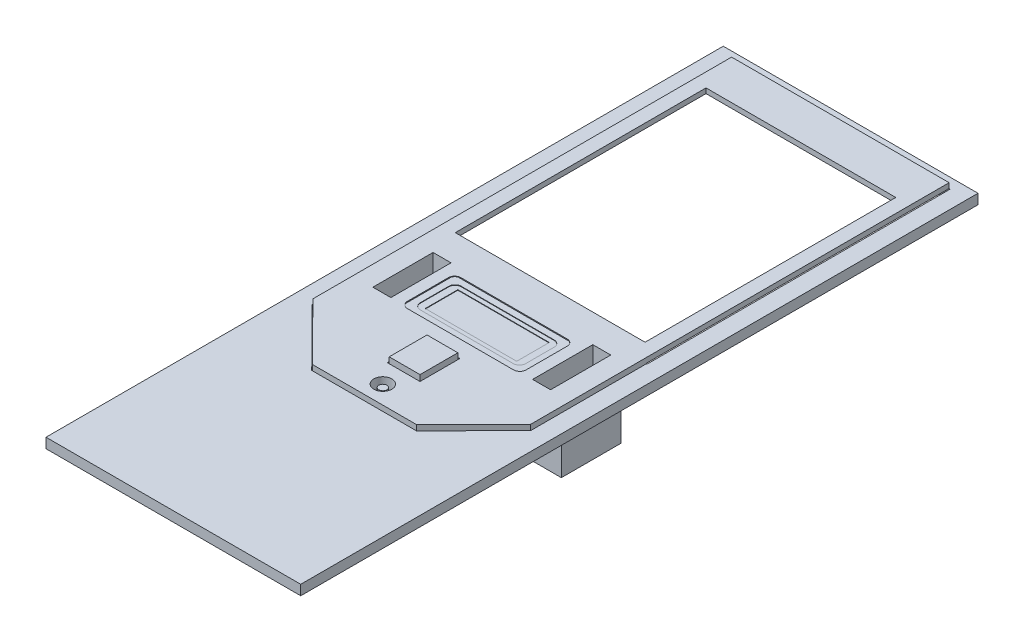
from build123d import *

# Parameters (mm, degrees)
SKETCH1_W                   = 51.332398317
SKETCH1_H                   = 136.325385694
BOSS_EXTRUDE1_DEPTH         = 2
CUT_EXTRUDE1_DEPTH          = 1
SKETCH3_W                   = 26.718092566
SKETCH3_H                   = 51.160838605
CUT_EXTRUDE2_DEPTH          = 1
SKETCH4_W                   = 20.659186536
SKETCH4_H                   = 13.604488078
BOSS_EXTRUDE2_DEPTH         = 1
SKETCH5_W                   = 6.521739131
SKETCH5_H                   = 14.853538096
SKETCH5_W_2                 = 6.52173913
SKETCH5_H_2                 = 15.644764374
CUT_EXTRUDE3_DEPTH          = 1
SKETCH6_W                   = 6.171107994
SKETCH6_H                   = 7.573632539
CUT_EXTRUDE4_DEPTH          = 1
SKETCH7_R                   = 2.489481066
CUT_EXTRUDE5_DEPTH          = 1
BOSS_EXTRUDE3_DEPTH         = 1
SKETCH10_W                  = 6.171107994
SKETCH10_H                  = 7.573632539
BOSS_EXTRUDE4_DEPTH         = 4
BOSS_EXTRUDE5_DEPTH         = 2
SKETCH12_W                  = 6.571107994
SKETCH12_H                  = 7.973632539
CUT_EXTRUDE6_DEPTH          = 2
SKETCH13_R                  = 1.8
SKETCH13_W                  = 26.718092566
SKETCH13_H                  = 51.160838605
CUT_EXTRUDE9_DEPTH          = 2
SKETCH14_R                  = 2.2
SKETCH14_R_2                = 1.8
BOSS_EXTRUDE11_DEPTH        = 2
SKETCH17_R                  = 2.2
BOSS_EXTRUDE12_DEPTH        = 1
SKETCH18_R                  = 0.8
BOSS_EXTRUDE15_DEPTH        = 3.4
EXTRUDE_THIN3_OUTLINE_W     = 5.6
EXTRUDE_THIN3_OUTLINE_H     = 14.844764374
EXTRUDE_THIN3_OUTLINE_W_2   = 3.6
EXTRUDE_THIN3_OUTLINE_H_2   = 12.844764374
EXTRUDE_THIN3_DEPTH         = 13.32398317
EXTRUDE_THIN3_2_OUTLINE_W   = 5.6
EXTRUDE_THIN3_2_OUTLINE_H   = 14.053538096
EXTRUDE_THIN3_2_OUTLINE_W_2 = 3.6
EXTRUDE_THIN3_2_OUTLINE_H_2 = 12.053538096
EXTRUDE_THIN3_2_DEPTH       = 13.32398317
SKETCH26_W                  = 3.6
SKETCH26_H                  = 12.053538096
SKETCH26_H_2                = 12.844764374
CUT_EXTRUDE12_DEPTH         = 13.32398317
SKETCH27_W                  = 5.6
SKETCH27_H                  = 14.053538096
BOSS_EXTRUDE18_DEPTH        = 1
SKETCH27_W_2                = 5.570395019
SKETCH27_H_2                = 14.844764374
BOSS_EXTRUDE18_2_DEPTH      = 1
SKETCH28_W                  = 20.659186536
SKETCH28_H                  = 13.604488078
CUT_EXTRUDE13_DEPTH         = 1
SKETCH29_W                  = 23.777559608
SKETCH29_H                  = 10.728152402
CUT_EXTRUDE15_DEPTH         = 10
SKETCH30_W                  = 23.777559608
SKETCH30_H                  = 10.728152402
SKETCH30_W_2                = 21.112762974
SKETCH30_H_2                = 8.203608222
BOSS_EXTRUDE20_DEPTH        = 1.8
SKETCH31_W                  = 21.112762974
SKETCH31_H                  = 8.203608222
BOSS_EXTRUDE21_DEPTH        = 1.6
SKETCH35_W                  = 23.977559608
SKETCH35_H                  = 10.928152402
CUT_EXTRUDE21_DEPTH         = 1.9
FILLET2_R                   = 1.25
FILLET3_R                   = 1.25
SKETCH37_W                  = 18.307713885
SKETCH37_H                  = 6.527591392
CUT_EXTRUDE22_DEPTH         = 0.1
SKETCH41_W                  = 18.307713885
SKETCH41_H                  = 6.527591392
BOSS_EXTRUDE27_DEPTH        = 0.1
SKETCH43_W                  = 18.307713885
SKETCH43_H                  = 6.527591392
BOSS_EXTRUDE28_DEPTH        = 0.1
CUT_EXTRUDE24_DEPTH         = 40.1
SKETCH51_W                  = 5.6
SKETCH51_H                  = 4.468914857
BOSS_EXTRUDE29_DEPTH        = 1
BOSS_EXTRUDE29_2_DEPTH      = 1
SKETCH52_W                  = 5.6
SKETCH52_H                  = 1
BOSS_EXTRUDE30_DEPTH        = 2.5
BOSS_EXTRUDE30_2_DEPTH      = 2.5
SKETCH53_W                  = 5.6
SKETCH53_H                  = 1
BOSS_EXTRUDE31_DEPTH        = 1
BOSS_EXTRUDE32_START        = 7.421556697
BOSS_EXTRUDE32_DEPTH        = 5.6
BOSS_EXTRUDE32_START_2      = -24.556002911
BOSS_EXTRUDE32_2_DEPTH      = 5.6
SKETCH55_W                  = 3.6
SKETCH55_H                  = 0.791226278
BOSS_EXTRUDE33_DEPTH        = 14.323983
SKETCH56_W                  = 0.791226278
SKETCH56_H                  = 13.32398317
CUT_EXTRUDE25_DEPTH         = 5.6
CUT_EXTRUDE_THIN1_DEPTH     = 1
SKETCH59_W                  = 71.33
SKETCH59_H                  = 156.33
SKETCH59_W_2                = 51.33
SKETCH59_H_2                = 136.33
CUT_EXTRUDE_THIN2_DEPTH     = 10
SKETCH60_W                  = 71
SKETCH60_H                  = 156
SKETCH60_W_2                = 51
SKETCH60_H_2                = 136
CUT_EXTRUDE_THIN3_DEPTH     = 10
SKETCH61_W                  = 51
SKETCH61_H                  = 2
CUT_EXTRUDE26_DEPTH         = 0.4
SKETCH62_W                  = 38
SKETCH62_H                  = 51.160838605
CUT_EXTRUDE28_DEPTH         = 10
SKETCH64_W                  = 38
SKETCH64_H                  = 0.08
BOSS_EXTRUDE35_DEPTH        = 2
SKETCH65_W                  = 38
SKETCH65_H                  = 0.08
BOSS_EXTRUDE37_DEPTH        = 1
SKETCH67_W                  = 44
SKETCH67_H                  = 61.400838605
CUT_EXTRUDE31_DEPTH         = 2
SKETCH69_W                  = 40.716981818
SKETCH69_H                  = 1
BOSS_EXTRUDE39_DEPTH        = 1.863286117
SKETCH70_W                  = 44
SKETCH70_H                  = 2
BOSS_EXTRUDE40_DEPTH        = 1
SKETCH71_W                  = 38
SKETCH71_H                  = 1
CUT_EXTRUDE32_DEPTH         = 1
SKETCH72_W                  = 38
SKETCH72_H                  = 1
BOSS_EXTRUDE41_DEPTH        = 1.8
SKETCH73_W                  = 44
SKETCH73_H                  = 2
CUT_EXTRUDE33_DEPTH         = 0.3
SKETCH74_W                  = 43.548387097
SKETCH74_H                  = 1
BOSS_EXTRUDE43_DEPTH        = 1.812426367


with BuildPart() as part:
    # Sketch1 → Boss-Extrude1 (new body)
    with BuildSketch(Plane(origin=(0, 0, 0), x_dir=(1, 0, 0), z_dir=(0, 1, 0))):
        with Locations((-5.767223106, -3.58751015)):
            Rectangle(SKETCH1_W, SKETCH1_H)
    extrude(amount=BOSS_EXTRUDE1_DEPTH)

    # Sketch2 → Cut-Extrude1 (cut)
    with BuildSketch(Plane(origin=(0, 2, 0), x_dir=(1, 0, 0), z_dir=(0, 1, 0))):
        Polygon((-27.541416655, -30.445855171), (-27.541416655, 60.542924633), (16.006970442, 60.542924633), (16.006970442, -30.445855171), (4.678976052, -41.666051524), (-16.213422265, -41.666051524), align=None)
    extrude(amount=-CUT_EXTRUDE1_DEPTH, mode=Mode.SUBTRACT)

    # Sketch3 → Cut-Extrude2 (cut)
    with BuildSketch(Plane(origin=(0, 1, 0), x_dir=(1, 0, 0), z_dir=(0, 1, 0))):
        with Locations((-5.767223107, 30.754931698)):
            Rectangle(SKETCH3_W, SKETCH3_H)
    extrude(amount=-CUT_EXTRUDE2_DEPTH, mode=Mode.SUBTRACT)

    # Sketch4 → Boss-Extrude2 (add)
    with BuildSketch(Plane(origin=(0, 1, 0), x_dir=(1, 0, 0), z_dir=(0, 1, 0))):
        with Locations((-5.767223107, -7.988180452)):
            Rectangle(SKETCH4_W, SKETCH4_H)
    extrude(amount=BOSS_EXTRUDE2_DEPTH)

    # Sketch5 → Cut-Extrude3 (cut)
    with BuildSketch(Plane(origin=(0, 1, 0), x_dir=(1, 0, 0), z_dir=(0, 1, 0))):
        with Locations((-21.756002911, -7.426769048)):
            Rectangle(SKETCH5_W, SKETCH5_H)
        with Locations((10.221556697, -7.031155909)):
            Rectangle(SKETCH5_W_2, SKETCH5_H_2)
    extrude(amount=-CUT_EXTRUDE3_DEPTH, mode=Mode.SUBTRACT)

    # Sketch6 → Cut-Extrude4 (cut)
    with BuildSketch(Plane(origin=(0, 1, 0), x_dir=(1, 0, 0), z_dir=(0, 1, 0))):
        with Locations((-5.767223107, -21.101784941)):
            Rectangle(SKETCH6_W, SKETCH6_H)
    extrude(amount=-CUT_EXTRUDE4_DEPTH, mode=Mode.SUBTRACT)

    # Sketch7 → Cut-Extrude5 (cut)
    with BuildSketch(Plane(origin=(0, 1, 0), x_dir=(1, 0, 0), z_dir=(0, 1, 0))):
        with Locations(Location((-5.767223107, -29.250452542, 0), (0, 0, 270))):
            Circle(SKETCH7_R)
    extrude(amount=-CUT_EXTRUDE5_DEPTH, mode=Mode.SUBTRACT)

    # Sketch8 → Boss-Extrude3 (add)
    with BuildSketch(Plane(origin=(0, 1, 0), x_dir=(1, 0, 0), z_dir=(0, 1, 0))):
        Polygon((-27.541416655, -21.480466567), (-27.541416655, -30.445855171), (-16.213422265, -41.666051524), (4.678976052, -41.666051524), (16.006970442, -30.445855171), (16.006970442, -21.480466567), (4.673870862, -32.903327717), (-16.208317076, -32.903327717), align=None)
    extrude(amount=BOSS_EXTRUDE3_DEPTH)

    # Sketch10 → Boss-Extrude4 (add)
    with BuildSketch(Plane.XZ):
        with Locations((-5.767223107, 21.101784941)):
            Rectangle(SKETCH10_W, SKETCH10_H)
    extrude(amount=-BOSS_EXTRUDE4_DEPTH)

    # Sketch28 → Cut-Extrude13 (cut)
    with BuildSketch(Plane(origin=(0, 2, 0), x_dir=(1, 0, 0), z_dir=(0, 1, 0))):
        with Locations((-5.767223107, -7.988180452)):
            Rectangle(SKETCH28_W, SKETCH28_H)
    extrude(amount=-CUT_EXTRUDE13_DEPTH, mode=Mode.SUBTRACT)


with BuildPart() as body_2:
    # Sketch11 → Boss-Extrude5 (new body)
    with BuildSketch(Plane(origin=(0, 1, 0), x_dir=(1, 0, 0), z_dir=(0, 1, 0))):
        Polygon((-27.541416655, 60.542924633), (16.006970442, 60.542924633), (16.006970442, -21.480466567), (4.673870862, -32.903327717), (-16.208317076, -32.903327717), (-27.541416655, -21.480466567), align=None)
    extrude(amount=BOSS_EXTRUDE5_DEPTH)

    # Sketch12 → Cut-Extrude6 (cut)
    with BuildSketch(Plane(origin=(0, 3, 0), x_dir=(1, 0, 0), z_dir=(0, 1, 0))):
        with Locations((-5.767223107, -21.10178494)):
            Rectangle(SKETCH12_W, SKETCH12_H)
    extrude(amount=-CUT_EXTRUDE6_DEPTH, mode=Mode.SUBTRACT)

    # Sketch13 → Cut-Extrude9 (cut)
    with BuildSketch(Plane.XZ.offset(-1)):
        with Locations(Location((-5.767223107, 29.250452542, 0), (0, 0, 270))):
            Circle(SKETCH13_R)
        with Locations((-5.767223107, -30.754931698)):
            Rectangle(SKETCH13_W, SKETCH13_H)
    extrude(amount=-CUT_EXTRUDE9_DEPTH, mode=Mode.SUBTRACT)


with BuildPart() as body_3:
    # Sketch14 → Boss-Extrude11 (new body)
    with BuildSketch(Plane.XZ.offset(-1)):
        with Locations(Location((-5.767223107, 29.250452542, 0), (0, 0, 270))):
            Circle(SKETCH14_R)
        with Locations(Location((-5.767223107, 29.250452542, 0), (0, 0, 270))):
            Circle(SKETCH14_R_2, mode=Mode.SUBTRACT)
    extrude(amount=BOSS_EXTRUDE11_DEPTH)

    # Combine1: union body 2
    add(body_2.part)

    # Sketch17 → Boss-Extrude12 (add)
    with BuildSketch(Plane.XZ.offset(1)):
        with Locations(Location((-5.767223107, 29.250452542, 0), (0, 0, 270))):
            Circle(SKETCH17_R)
    extrude(amount=BOSS_EXTRUDE12_DEPTH)


with BuildPart() as body_3_2:
    # Sketch18 → Boss-Extrude15 (new body)
    with BuildSketch(Plane(origin=(0, -1, 0), x_dir=(1, 0, 0), z_dir=(0, 1, 0))):
        with Locations(Location((-5.767223107, -29.250452542, 0), (0, 0, 270))):
            Circle(SKETCH18_R)
    extrude(amount=BOSS_EXTRUDE15_DEPTH)


with BuildPart() as body_3_1:
    add(body_3.part)

    # Combine3: union body 3 2
    add(body_3_2.part)

    # Sketch26 → Cut-Extrude12 (cut)
    with BuildSketch(Plane.XZ.offset(-1)):
        with Locations((-21.756002911, 7.426769048)):
            Rectangle(SKETCH26_W, SKETCH26_H)
        with Locations((10.221556697, 7.031155909)):
            Rectangle(SKETCH26_W, SKETCH26_H_2)
    extrude(amount=-CUT_EXTRUDE12_DEPTH, mode=Mode.SUBTRACT)


with BuildPart() as body_3_3:
    # Extrude-Thin3: read off the stored shape, not the designer's step
    # Extrude-Thin3 outline → Extrude-Thin3 (new body)
    with BuildSketch(Plane.XZ.offset(-1)):
        with Locations((10.221556697, 7.031155909)):
            Rectangle(EXTRUDE_THIN3_OUTLINE_W, EXTRUDE_THIN3_OUTLINE_H)
        with Locations((10.221556697, 7.031155909)):
            Rectangle(EXTRUDE_THIN3_OUTLINE_W_2, EXTRUDE_THIN3_OUTLINE_H_2, mode=Mode.SUBTRACT)
    extrude(amount=EXTRUDE_THIN3_DEPTH)


with BuildPart() as body_4:
    # Extrude-Thin3 2 outline → Extrude-Thin3 2 (new body)
    with BuildSketch(Plane.XZ.offset(-1)):
        with Locations((-21.756002911, 7.426769048)):
            Rectangle(EXTRUDE_THIN3_2_OUTLINE_W, EXTRUDE_THIN3_2_OUTLINE_H)
        with Locations((-21.756002911, 7.426769048)):
            Rectangle(EXTRUDE_THIN3_2_OUTLINE_W_2, EXTRUDE_THIN3_2_OUTLINE_H_2, mode=Mode.SUBTRACT)
    extrude(amount=EXTRUDE_THIN3_2_DEPTH)


with BuildPart() as body_5:
    # Sketch27 → Boss-Extrude18 (new body)
    with BuildSketch(Plane.XZ.offset(12.32398317)):
        with Locations((-21.756002911, 7.426769048)):
            Rectangle(SKETCH27_W, SKETCH27_H)
    extrude(amount=-BOSS_EXTRUDE18_DEPTH)


with BuildPart() as body_6:
    # Sketch27 → Boss-Extrude18 2 (new body)
    with BuildSketch(Plane.XZ.offset(12.32398317)):
        with Locations((10.206754207, 7.031155909)):
            Rectangle(SKETCH27_W_2, SKETCH27_H_2)
    extrude(amount=-BOSS_EXTRUDE18_2_DEPTH)


with BuildPart() as body_4_1:
    add(body_4.part)

    # Combine4: union body 3 3, body 3, body 5, body 6
    add(body_3_3.part)
    add(body_3_1.part)
    add(body_5.part)
    add(body_6.part)

    # Sketch29 → Cut-Extrude15 (cut)
    with BuildSketch(Plane(origin=(0, 3, 0), x_dir=(1, 0, 0), z_dir=(0, 1, 0))):
        with Locations((-5.767223107, -8.341916313)):
            Rectangle(SKETCH29_W, SKETCH29_H)
    extrude(amount=-CUT_EXTRUDE15_DEPTH, mode=Mode.SUBTRACT)

    # Sketch35 → Cut-Extrude21 (cut)
    with BuildSketch(Plane.XZ.offset(-1)):
        with Locations((-5.767223107, 8.341916313)):
            Rectangle(SKETCH35_W, SKETCH35_H)
    extrude(amount=-CUT_EXTRUDE21_DEPTH, mode=Mode.SUBTRACT)

    # Fillet2
    fillet2_edges = [body_4_1.edges().sort_by_distance(p)[0] for p in [
        (-17.656002911, 2.95, 13.705992514),
        (6.121556697, 2.95, 13.705992514),
        (6.121556697, 2.95, 2.977840112),
        (-17.656002911, 2.95, 2.977840112),
    ]]
    fillet(fillet2_edges, radius=FILLET2_R)

    # Sketch50 → Cut-Extrude24 (cut)
    with BuildSketch(Plane(origin=(13.021556697, 0, 0), x_dir=(0, 0, -1), z_dir=(1, 0, 0))):
        Polygon((-14.453538096, 1), (-11.293538096, -2.16), (-11.293538096, -12.32398317), (-14.453538096, -12.32398317), align=None)
    extrude(amount=-CUT_EXTRUDE24_DEPTH, mode=Mode.SUBTRACT)


with BuildPart() as body_3_4:
    # Sketch30 → Boss-Extrude20 (new body)
    with BuildSketch(Plane(origin=(0, 1, 0), x_dir=(1, 0, 0), z_dir=(0, 1, 0))):
        with Locations((-5.767223107, -8.341916313)):
            Rectangle(SKETCH30_W, SKETCH30_H)
        with Locations((-5.767223107, -8.341916313)):
            Rectangle(SKETCH30_W_2, SKETCH30_H_2, mode=Mode.SUBTRACT)
    extrude(amount=BOSS_EXTRUDE20_DEPTH)


with BuildPart() as body_4_2:
    # Sketch31 → Boss-Extrude21 (new body)
    with BuildSketch(Plane(origin=(0, 1, 0), x_dir=(1, 0, 0), z_dir=(0, 1, 0))):
        with Locations((-5.767223107, -8.341916313)):
            Rectangle(SKETCH31_W, SKETCH31_H)
    extrude(amount=BOSS_EXTRUDE21_DEPTH)


with BuildPart() as part_1:
    add(part.part)

    # Combine5: union body 3 4, body 4 2
    add(body_3_4.part)
    add(body_4_2.part)

    # Fillet3
    fillet3_edges = [part_1.edges().sort_by_distance(p)[0] for p in [
        (-16.323604594, 2.7, 12.443720424),
        (4.78915838, 2.7, 12.443720424),
        (4.78915838, 2.7, 4.240112202),
        (-16.323604594, 2.7, 4.240112202),
    ]]
    fillet(fillet3_edges, radius=FILLET3_R)

    # Sketch37 → Cut-Extrude22 (cut)
    with BuildSketch(Plane(origin=(0, 2.6, 0), x_dir=(1, 0, 0), z_dir=(0, 1, 0))):
        with Locations((-5.767223107, -8.341916313)):
            Rectangle(SKETCH37_W, SKETCH37_H)
    extrude(amount=-CUT_EXTRUDE22_DEPTH, mode=Mode.SUBTRACT)


with BuildPart() as body_3_5:
    # Sketch41 → Boss-Extrude27 (new body)
    with BuildSketch(Plane(origin=(0, 2.6, 0), x_dir=(1, 0, 0), z_dir=(0, 1, 0))):
        with BuildLine():
            Line((-15.073604594, -12.443720424), (3.53915838, -12.443720424))
            ThreePointArc((3.53915838, -12.443720424), (4.423041856, -12.077603901), (4.78915838, -11.193720424))
            Line((4.78915838, -11.193720424), (4.78915838, -5.490112202))
            ThreePointArc((4.78915838, -5.490112202), (4.423041856, -4.606228725), (3.53915838, -4.240112202))
            Line((3.53915838, -4.240112202), (-15.073604594, -4.240112202))
            ThreePointArc((-15.073604594, -4.240112202), (-15.95748807, -4.606228725), (-16.323604594, -5.490112202))
            Line((-16.323604594, -5.490112202), (-16.323604594, -11.193720424))
            ThreePointArc((-16.323604594, -11.193720424), (-15.95748807, -12.077603901), (-15.073604594, -12.443720424))
        make_face()
        with Locations((-5.767223107, -8.341916313)):
            Rectangle(SKETCH41_W, SKETCH41_H, mode=Mode.SUBTRACT)
    extrude(amount=BOSS_EXTRUDE27_DEPTH)

    # Combine6: union part
    add(part_1.part)


with BuildPart() as body_3_6:
    # Sketch43 → Boss-Extrude28 (new body)
    with BuildSketch(Plane(origin=(0, 2.5, 0), x_dir=(1, 0, 0), z_dir=(0, 1, 0))):
        with Locations((-5.767223107, -8.341916313)):
            Rectangle(SKETCH43_W, SKETCH43_H)
    extrude(amount=BOSS_EXTRUDE28_DEPTH)

    # Combine7: union body 3 5
    add(body_3_5.part)

    # Sketch58 → Cut-Extrude-Thin1 (cut)
    with BuildSketch(Plane(origin=(0, 1, 0), x_dir=(1, 0, 0), z_dir=(0, 1, 0))):
        Polygon((-16.249969686, -33.003327717), (4.715523472, -33.003327717), (16.106970442, -21.521657048), (16.106970442, 60.642924633), (-27.641416655, 60.642924633), (-27.641416655, -21.521657048), align=None)
        Polygon((-16.208317076, -32.903327717), (4.673870862, -32.903327717), (16.006970442, -21.480466567), (16.006970442, 60.542924633), (-27.541416655, 60.542924633), (-27.541416655, -21.480466567), align=None, mode=Mode.SUBTRACT)
    extrude(amount=CUT_EXTRUDE_THIN1_DEPTH, mode=Mode.SUBTRACT)

    # Sketch59 → Cut-Extrude-Thin2 (cut)
    with BuildSketch(Plane(origin=(0, 2, 0), x_dir=(1, 0, 0), z_dir=(0, 1, 0))):
        with Locations((-5.767223107, -3.58751015)):
            Rectangle(SKETCH59_W, SKETCH59_H)
        with Locations((-5.767223107, -3.58751015)):
            Rectangle(SKETCH59_W_2, SKETCH59_H_2, mode=Mode.SUBTRACT)
    extrude(amount=-CUT_EXTRUDE_THIN2_DEPTH, mode=Mode.SUBTRACT)

    # Sketch60 → Cut-Extrude-Thin3 (cut)
    with BuildSketch(Plane(origin=(0, 2, 0), x_dir=(1, 0, 0), z_dir=(0, 1, 0))):
        with Locations((-5.767223107, -3.58751015)):
            Rectangle(SKETCH60_W, SKETCH60_H)
        with Locations((-5.767223107, -3.58751015)):
            Rectangle(SKETCH60_W_2, SKETCH60_H_2, mode=Mode.SUBTRACT)
    extrude(amount=-CUT_EXTRUDE_THIN3_DEPTH, mode=Mode.SUBTRACT)

    # Sketch61 → Cut-Extrude26 (cut)
    with BuildSketch(Plane.XY.offset(71.58751015)):
        with Locations((-5.767223107, 1)):
            Rectangle(SKETCH61_W, SKETCH61_H)
    extrude(amount=-CUT_EXTRUDE26_DEPTH, mode=Mode.SUBTRACT)


with BuildPart() as body_3_7:
    # Sketch51 → Boss-Extrude29 (new body)
    with BuildSketch(Plane(origin=(0, -6.726769048, 6.726769048), x_dir=(1, 0, 0), z_dir=(0, -0.7071067811865475, 0.7071067811865476))):
        with Locations((10.221556697, 8.692844153)):
            Rectangle(SKETCH51_W, SKETCH51_H)
    extrude(amount=BOSS_EXTRUDE29_DEPTH)


with BuildPart() as body_4_3:
    # Sketch51 → Boss-Extrude29 2 (new body)
    with BuildSketch(Plane(origin=(0, -6.726769048, 6.726769048), x_dir=(1, 0, 0), z_dir=(0, -0.7071067811865475, 0.7071067811865476))):
        with Locations((-21.756002911, 8.692844153)):
            Rectangle(SKETCH51_W, SKETCH51_H)
    extrude(amount=BOSS_EXTRUDE29_2_DEPTH)


with BuildPart() as body_5_2:
    # Sketch52 → Boss-Extrude30 (new body)
    with BuildSketch(Plane(origin=(0, 7.726769048, 7.726769048), x_dir=(1, 0, 0), z_dir=(0, 0.7071067811865476, 0.7071067811865475))):
        with Locations((10.221556697, -10.013088019)):
            Rectangle(SKETCH52_W, SKETCH52_H)
    extrude(amount=BOSS_EXTRUDE30_DEPTH)


with BuildPart() as body_6_2:
    # Sketch52 → Boss-Extrude30 2 (new body)
    with BuildSketch(Plane(origin=(0, 7.726769048, 7.726769048), x_dir=(1, 0, 0), z_dir=(0, 0.7071067811865476, 0.7071067811865475))):
        with Locations((-21.756002911, -10.013088019)):
            Rectangle(SKETCH52_W, SKETCH52_H)
    extrude(amount=BOSS_EXTRUDE30_2_DEPTH)


with BuildPart() as body_4_4:
    add(body_4_1.part)

    # Combine8: union body 3 7, body 4 3, body 5 2, body 6 2
    add(body_3_7.part)
    add(body_4_3.part)
    add(body_5_2.part)
    add(body_6_2.part)

    # Sketch53 → Boss-Extrude31 (add)
    with BuildSketch(Plane.XY.offset(11.293538096)):
        with Locations((-21.756002911, -11.82398317)):
            Rectangle(SKETCH53_W, SKETCH53_H)
        with Locations((10.221556697, -11.82398317)):
            Rectangle(SKETCH53_W, SKETCH53_H)
    extrude(amount=BOSS_EXTRUDE31_DEPTH)


with BuildPart() as body_3_8:
    # Boss-Extrude32: read off the stored shape, not the designer's step
    # Boss-Extrude32 outline → Boss-Extrude32 (new body)
    with BuildSketch(Plane.YZ.offset(BOSS_EXTRUDE32_START)):
        Polygon((-11.32398317, 11.293538096), (-2.16, 11.293538096), (-2.867106781, 12.000644877), (-2.574213562, 12.293538096), (-11.32398317, 12.293538096), align=None)
    extrude(amount=BOSS_EXTRUDE32_DEPTH)


with BuildPart() as body_4_4_1:
    # Boss-Extrude32 2 outline → Boss-Extrude32 2 (new body)
    with BuildSketch(Plane.YZ.offset(BOSS_EXTRUDE32_START_2)):
        Polygon((-11.32398317, 11.293538096), (-2.16, 11.293538096), (-2.867106781, 12.000644877), (-2.574213562, 12.293538096), (-11.32398317, 12.293538096), align=None)
    extrude(amount=BOSS_EXTRUDE32_2_DEPTH)


with BuildPart() as body_4_5:
    add(body_4_4.part)

    # Combine9: union body 4 4, body 3 8
    add(body_4_4_1.part)
    add(body_3_8.part)

    # Sketch55 → Boss-Extrude33 (add)
    with BuildSketch(Plane(origin=(0, -11.32398317, 0), x_dir=(1, 0, 0), z_dir=(0, 1, 0))):
        with Locations((10.221556697, -1.004386861)):
            Rectangle(SKETCH55_W, SKETCH55_H)
    extrude(amount=BOSS_EXTRUDE33_DEPTH)

    # Sketch56 → Cut-Extrude25 (cut)
    with BuildSketch(Plane.ZY.offset(-7.421556697)):
        with Locations((0.004386861, -5.661991585)):
            Rectangle(SKETCH56_W, SKETCH56_H)
    extrude(amount=-CUT_EXTRUDE25_DEPTH, mode=Mode.SUBTRACT)


with BuildPart() as cut_extrude28_tool:
    # Sketch62 → Cut-Extrude28 (new body)
    with BuildSketch(Plane(origin=(0, 3, 0), x_dir=(1, 0, 0), z_dir=(0, 1, 0))):
        with Locations((-5.767223107, 30.754931698)):
            Rectangle(SKETCH62_W, SKETCH62_H)
    extrude(amount=-CUT_EXTRUDE28_DEPTH)


with BuildPart() as body_4_6:
    add(body_4_5.part)

    # Cut-Extrude28: cut by cut_extrude28_tool
    add(cut_extrude28_tool.part, mode=Mode.SUBTRACT)

    # Sketch64 → Boss-Extrude35 (add)
    with BuildSketch(Plane(origin=(0, 3, 0), x_dir=(1, 0, 0), z_dir=(0, 1, 0))):
        with Locations((-5.767223107, 5.214512395)):
            Rectangle(SKETCH64_W, SKETCH64_H)
        with Locations((-5.767223107, 56.295351)):
            Rectangle(SKETCH64_W, SKETCH64_H)
    extrude(amount=-BOSS_EXTRUDE35_DEPTH)


with BuildPart() as body_3_6_1:
    add(body_3_6.part)

    # Cut-Extrude28: cut by cut_extrude28_tool
    add(cut_extrude28_tool.part, mode=Mode.SUBTRACT)

    # Sketch65 → Boss-Extrude37 (add)
    with BuildSketch(Plane.XZ):
        with Locations((-5.767223107, -5.214512395)):
            Rectangle(SKETCH65_W, SKETCH65_H)
        with Locations((-5.767223107, -56.295351)):
            Rectangle(SKETCH65_W, SKETCH65_H)
    extrude(amount=-BOSS_EXTRUDE37_DEPTH)


with BuildPart() as cut_extrude31_tool:
    # Sketch67 → Cut-Extrude31 (new body)
    with BuildSketch(Plane.XZ):
        with Locations((-5.767223107, -32.354931697)):
            Rectangle(SKETCH67_W, SKETCH67_H)
    extrude(amount=-CUT_EXTRUDE31_DEPTH)


with BuildPart() as body_4_7:
    add(body_4_6.part)

    # Cut-Extrude31: cut by cut_extrude31_tool
    add(cut_extrude31_tool.part, mode=Mode.SUBTRACT)

    # Sketch71 → Cut-Extrude32 (cut)
    with BuildSketch(Plane(origin=(0, 0, -5.254512395), x_dir=(-1, 0, 0), z_dir=(0, 0, -1))):
        with Locations((5.767223107, 2.5)):
            Rectangle(SKETCH71_W, SKETCH71_H)
    extrude(amount=-CUT_EXTRUDE32_DEPTH, mode=Mode.SUBTRACT)

    # Sketch72 → Boss-Extrude41 (add)
    with BuildSketch(Plane.XY.offset(-56.255351)):
        with Locations((-5.767223107, 2.5)):
            Rectangle(SKETCH72_W, SKETCH72_H)
    extrude(amount=BOSS_EXTRUDE41_DEPTH)

    # Sketch74 → Boss-Extrude43 (add)
    with BuildSketch(Plane(origin=(0, 0, -60.542924633), x_dir=(-1, 0, 0), z_dir=(0, 0, -1))):
        with Locations((5.767223107, 2.5)):
            Rectangle(SKETCH74_W, SKETCH74_H)
    extrude(amount=BOSS_EXTRUDE43_DEPTH)


with BuildPart() as body_3_6_2:
    add(body_3_6_1.part)

    # Cut-Extrude31: cut by cut_extrude31_tool
    add(cut_extrude31_tool.part, mode=Mode.SUBTRACT)

    # Sketch69 → Boss-Extrude39 (add)
    with BuildSketch(Plane(origin=(0, 0, -1.654512395), x_dir=(-1, 0, 0), z_dir=(0, 0, -1))):
        with Locations((6.105401472, 0.5)):
            Rectangle(SKETCH69_W, SKETCH69_H)
    extrude(amount=-BOSS_EXTRUDE39_DEPTH)

    # Sketch70 → Boss-Extrude40 (add)
    with BuildSketch(Plane.XY.offset(-63.055351)):
        with Locations((-5.767223107, 1)):
            Rectangle(SKETCH70_W, SKETCH70_H)
    extrude(amount=BOSS_EXTRUDE40_DEPTH)

    # Sketch73 → Cut-Extrude33 (cut)
    with BuildSketch(Plane.XY.offset(-62.055351)):
        with Locations((-5.767223107, 1)):
            Rectangle(SKETCH73_W, SKETCH73_H)
    extrude(amount=-CUT_EXTRUDE33_DEPTH, mode=Mode.SUBTRACT)


solid = Compound([body_4_7.part, body_3_6_2.part])
